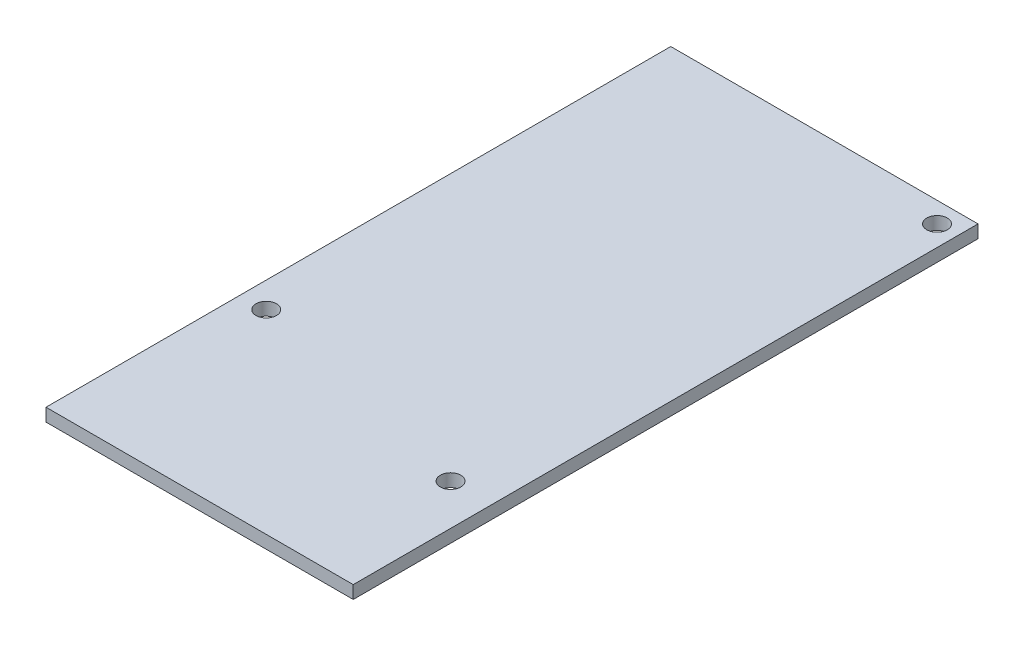
from build123d import *

# Parameters (mm, degrees)
SKETCH1_W                   = 38.1
SKETCH1_H                   = 93.98
BOSS_EXTRUDE1_DEPTH         = 1.6
CUT_EXTRUDE1_DEPTH          = 51.729898482
CUT_EXTRUDE1_DEPTH_BACK     = 51.729898482
SKETCH2_R                   = 1.27
CUT_EXTRUDE2_DEPTH          = 51.729898482
CUT_EXTRUDE2_DEPTH_BACK     = 51.729898482
SKETCH3_R                   = 1.27
SKETCH3_W                   = 38.1
SKETCH3_H                   = 16.505
BODY_MOVE_COPY1_DEPTH       = 1.6
BODY_MOVE_COPY1_2_OUTLINE_W = 38.1
BODY_MOVE_COPY1_2_OUTLINE_H = 16.505
BODY_MOVE_COPY1_2_OUTLINE_R = 1.27
BODY_MOVE_COPY1_2_DEPTH     = 1.6


# Read off the part's stored shape, not the designer's step: Body-Move/Copy1
with BuildPart() as part:
    # Sketch1 → Boss-Extrude1 (new body)
    with BuildSketch(Plane(origin=(0, 0, 0), x_dir=(1, 0, 0), z_dir=(0, 1, 0))):
        Rectangle(SKETCH1_W, SKETCH1_H)
    extrude(amount=BOSS_EXTRUDE1_DEPTH)

    # Sketch2 → Cut-Extrude1 (cut, two sides: drawn at the far end of the back side and taken through both)
    with BuildSketch(Plane(origin=(0, 1.6, 0), x_dir=(1, 0, 0), z_dir=(0, 1, 0)).offset(-CUT_EXTRUDE1_DEPTH_BACK)):
        with Locations(Location((13.97, -29.84, 0), (0, 0, 270))):
            Circle(SKETCH2_R)
        with Locations(Location((-15.875, -6.35, 0), (0, 0, 270))):
            Circle(SKETCH2_R)
        with Locations(Location((16.51, 44.45, 0), (0, 0, 270))):
            Circle(SKETCH2_R)
    extrude(amount=CUT_EXTRUDE1_DEPTH + CUT_EXTRUDE1_DEPTH_BACK, mode=Mode.SUBTRACT)

    # Sketch3 → Cut-Extrude2 (cut, two sides: drawn at the far end of the back side and taken through both)
    with BuildSketch(Plane(origin=(0, 1.6, 0), x_dir=(1, 0, 0), z_dir=(0, 1, 0)).offset(-CUT_EXTRUDE2_DEPTH_BACK)):
        with Locations(Location((-15.875, -6.35, 0), (0, 0, 270))):
            Circle(SKETCH3_R)
        with Locations((0, -18.5875)):
            Rectangle(SKETCH3_W, SKETCH3_H)
    extrude(amount=CUT_EXTRUDE2_DEPTH + CUT_EXTRUDE2_DEPTH_BACK, mode=Mode.SUBTRACT)


with BuildPart() as cut_extrude2_piece_1:
    # of the separate pieces the step leaves, piece 1, a body of its own (cut_extrude2_pieces)
    add(part.part.solids().sort_by_distance((-19.05, 0, -46.99))[0])


with BuildPart() as cut_extrude2_piece_2:
    # of the separate pieces the step leaves, piece 2, a body of its own (cut_extrude2_pieces)
    add(part.part.solids().sort_by_distance((-19.05, 0, 46.99))[0])

    # Body-Move/Copy1 outline → Body-Move/Copy1 (cut)
    with BuildSketch(Plane(origin=(0, 0, 0), x_dir=(1, 0, 0), z_dir=(0, 1, 0))):
        with BuildLine():
            Line((12.875982176, -30.485), (-19.05, -30.485))
            Line((-19.05, -30.485), (-19.05, -46.99))
            Line((-19.05, -46.99), (19.05, -46.99))
            Line((19.05, -46.99), (19.05, -30.485))
            Line((19.05, -30.485), (15.064017824, -30.485))
            ThreePointArc((15.064017824, -30.485), (13.97, -31.11), (12.875982176, -30.485))
        make_face()
    extrude(amount=BODY_MOVE_COPY1_DEPTH, mode=Mode.SUBTRACT)

    # Body-Move_Copy1 2 outline → Body-Move_Copy1 2 (add)
    # profile 1 of 2: a face of its own
    with BuildSketch(Plane(origin=(0, 0, 0), x_dir=(1, 0, 0), z_dir=(0, 1, 0))):
        with Locations((0, -18.5875)):
            Rectangle(BODY_MOVE_COPY1_2_OUTLINE_W, BODY_MOVE_COPY1_2_OUTLINE_H)
        with Locations((13.97, -13.335)):
            Circle(BODY_MOVE_COPY1_2_OUTLINE_R, mode=Mode.SUBTRACT)
    # profile 2 of 2: a face of its own
    with BuildSketch(Plane(origin=(0, 0, 0), x_dir=(1, 0, 0), z_dir=(0, 1, 0))):
        with BuildLine():
            ThreePointArc((15.064017824, -30.485), (13.97, -28.57), (12.875982176, -30.485))
            Line((12.875982176, -30.485), (15.064017824, -30.485))
        make_face()
    extrude(amount=BODY_MOVE_COPY1_2_DEPTH)

    # Combine1: union Cut-Extrude2 piece 1
    add(cut_extrude2_piece_1.part)


solid = cut_extrude2_piece_2.part
